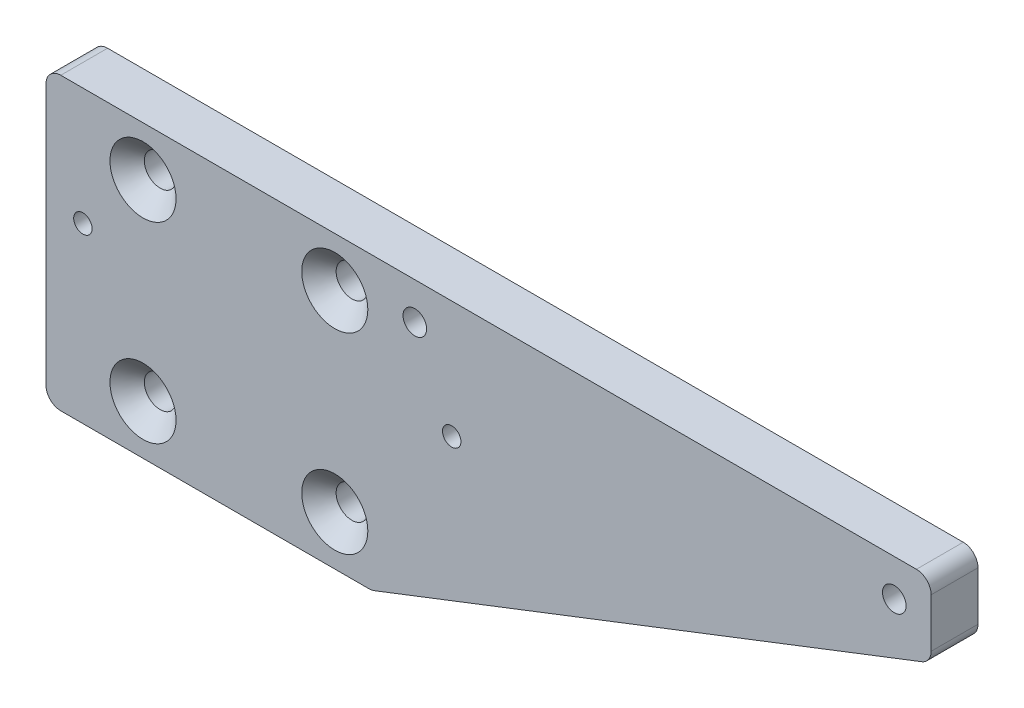
from build123d import *

# Parameters (mm, degrees)
BOSS_EXTRUDE1_DEPTH           = 6.35
CSK_FOR_M4_SFHCS2_D           = 4.3
CSK_FOR_M4_SFHCS2_CSINK_D     = 8.96
CSK_FOR_M4_SFHCS2_CSINK_ANGLE = 90
CSK_FOR_M4_SFHCS1_D           = 4.3
CSK_FOR_M4_SFHCS1_CSINK_D     = 8.96
CSK_FOR_M4_SFHCS1_CSINK_ANGLE = 90
TAP_DRILL_FOR_M3X0_5_TAP1_D   = 2.5
M3_CLEARANCE_HOLE2_D          = 3.2
FILLET1_R                     = 2


with BuildPart() as part:
    # Sketch1 → Boss-Extrude1 (new body)
    with BuildSketch(Plane.XY):
        Polygon((22.075, 19.7), (97.925, 19.7), (97.925, 9.7), (22.075, -19.7), (-22.075, -19.7), (-22.075, 19.7), align=None)
    extrude(amount=BOSS_EXTRUDE1_DEPTH)

    # CSK for M4 SFHCS2 (through all)
    with Locations(Plane.XY.offset(6.35)):
        with Locations((17.075, 13), (-8.925, 13)):
            CounterSinkHole(CSK_FOR_M4_SFHCS2_D / 2, CSK_FOR_M4_SFHCS2_CSINK_D / 2, counter_sink_angle=CSK_FOR_M4_SFHCS2_CSINK_ANGLE)

    # CSK for M4 SFHCS1 (through all)
    with Locations(Plane.XY.offset(6.35)):
        with Locations((-8.925, -13), (17.075, -13)):
            CounterSinkHole(CSK_FOR_M4_SFHCS1_D / 2, CSK_FOR_M4_SFHCS1_CSINK_D / 2, counter_sink_angle=CSK_FOR_M4_SFHCS1_CSINK_ANGLE)

    # Tap Drill for M3x0.5 Tap1 (through all)
    with Locations(Plane.XY.offset(6.35)):
        with Locations((-17.075, 3.8), (32.925, 3.8)):
            Hole(TAP_DRILL_FOR_M3X0_5_TAP1_D / 2)

    # M3 Clearance Hole2 (through all)
    with Locations(Plane(origin=(0, 0, 0), x_dir=(-1, 0, 0), z_dir=(0, 0, -1))):
        with Locations((-92.925, 14.7), (-27.925, 14.7)):
            Hole(M3_CLEARANCE_HOLE2_D / 2)

    # Fillet1
    fillet1_edges = [part.edges().sort_by_distance(p)[0] for p in [
        (22.075, -19.7, 3.175),
        (-22.075, -19.7, 3.175),
        (97.925, 19.7, 3.175),
        (-22.075, 19.7, 3.175),
        (97.925, 9.7, 3.175),
    ]]
    fillet(fillet1_edges, radius=FILLET1_R)


solid = part.part
